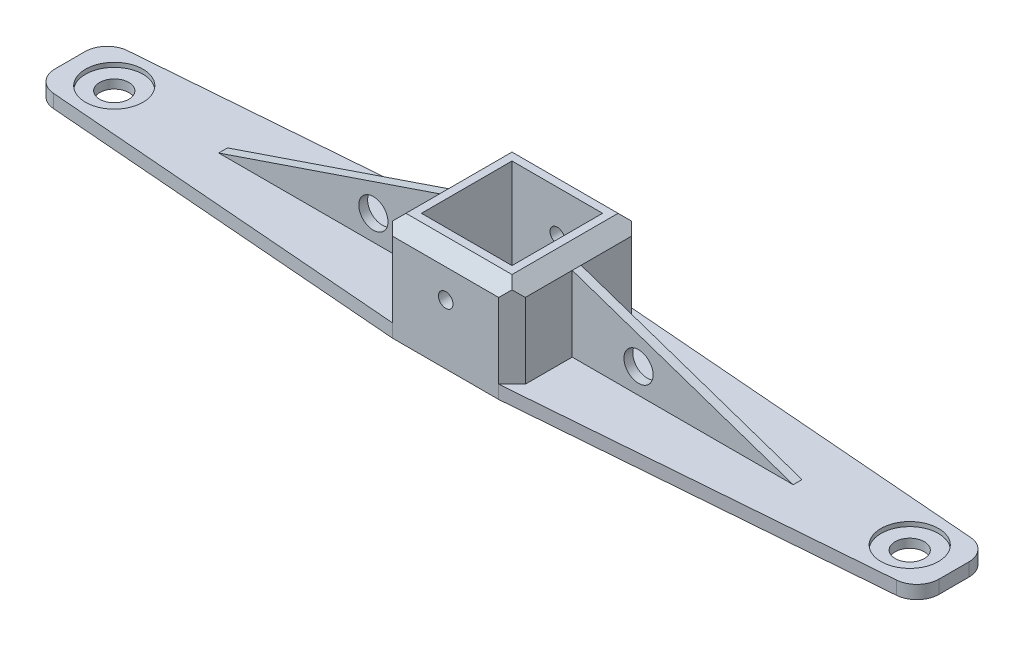
from build123d import *

# Parameters (mm, degrees)
SKETCH1_W           = 200
SKETCH1_H           = 30
BOSS_EXTRUDE1_DEPTH = 3
SKETCH2_W           = 20.5
SKETCH2_H           = 20.5
CUT_EXTRUDE1_DEPTH  = 3
SKETCH3_W           = 30
SKETCH3_H           = 30
SKETCH3_W_2         = 20.5
SKETCH3_H_2         = 20.5
BOSS_EXTRUDE2_DEPTH = 20
CHAMFER1_SIZE       = 3
SKETCH4_R           = 1.65
CUT_EXTRUDE2_DEPTH  = 40
CHAMFER2_SIZE       = 3
CUT_EXTRUDE3_DEPTH  = 40
SKETCH6_W           = 50
SKETCH6_H           = 2
BOSS_EXTRUDE3_DEPTH = 17
CUT_EXTRUDE4_DEPTH  = 17
SKETCH8_R           = 3.302
CUT_EXTRUDE5_DEPTH  = 17
SKETCH9_R           = 3.302
CUT_EXTRUDE6_DEPTH  = 17
SKETCH10_R          = 6.5
CUT_EXTRUDE7_DEPTH  = 1
SKETCH11_R          = 6.5
CUT_EXTRUDE8_DEPTH  = 1
FILLET1_R           = 5


with BuildPart() as part:
    # Sketch1 → Boss-Extrude1 (new body)
    with BuildSketch(Plane(origin=(0, 0, 0), x_dir=(1, 0, 0), z_dir=(0, 1, 0))):
        Rectangle(SKETCH1_W, SKETCH1_H)
    extrude(amount=BOSS_EXTRUDE1_DEPTH)

    # Sketch2 → Cut-Extrude1 (cut)
    with BuildSketch(Plane(origin=(0, 3, 0), x_dir=(1, 0, 0), z_dir=(0, 1, 0))):
        Rectangle(SKETCH2_W, SKETCH2_H)
    extrude(amount=-CUT_EXTRUDE1_DEPTH, mode=Mode.SUBTRACT)

    # Sketch3 → Boss-Extrude2 (add)
    with BuildSketch(Plane(origin=(0, 3, 0), x_dir=(1, 0, 0), z_dir=(0, 1, 0))):
        Rectangle(SKETCH3_W, SKETCH3_H)
        Rectangle(SKETCH3_W_2, SKETCH3_H_2, mode=Mode.SUBTRACT)
    extrude(amount=BOSS_EXTRUDE2_DEPTH)

    # Chamfer1
    chamfer1_edges = [part.edges().sort_by_distance(p)[0] for p in [
        (15, 13, 15),
        (15, 13, -15),
        (-15, 13, -15),
        (-15, 13, 15),
    ]]
    chamfer(chamfer1_edges, length=CHAMFER1_SIZE)

    # Sketch4 → Cut-Extrude2 (cut)
    with BuildSketch(Plane.XY.offset(15)):
        with Locations((0, 13.514664597)):
            Circle(SKETCH4_R)
    extrude(amount=-CUT_EXTRUDE2_DEPTH, mode=Mode.SUBTRACT)

    # Chamfer2
    # the kernel refuses this chamfer: 3 mm, written as the material it takes off along each edge
    with BuildSketch(Plane(origin=(19.715048964, 23, -15), x_dir=(0, -0.9996219169112968, -0.02749587661058619), z_dir=(-1, 0, 0))) as chamfer2_piece_1:
        Polygon((CHAMFER2_SIZE * 0.999621916911, CHAMFER2_SIZE * 0.0274958766106), (-CHAMFER2_SIZE * 0.0274958766106, CHAMFER2_SIZE * 0.999621916911), (0, 0), align=None)
    extrude(amount=39.430097928, mode=Mode.SUBTRACT)
    with BuildSketch(Plane(origin=(15, 23, 19.715048964), x_dir=(-0.9996219169112968, 0.02749587661058678, 0), z_dir=(0, 0, -1)), Plane(origin=(-19.715048964, 23, 15), x_dir=(0, 0.02749587661058678, -0.9996219169112968), z_dir=(1, 0, 0)), Plane(origin=(-15, 23, -19.715048964), x_dir=(0.9996219169112968, 0.02749587661058678, 0), z_dir=(0, 0, 1))) as chamfer2_piece_2:
        Polygon((CHAMFER2_SIZE * 0.999621916911, -CHAMFER2_SIZE * 0.0274958766106), (-CHAMFER2_SIZE * 0.0274958766106, -CHAMFER2_SIZE * 0.999621916911), (0, 0), align=None)
    extrude(amount=39.430097928, mode=Mode.SUBTRACT)

    # Sketch5 → Cut-Extrude3 (cut)
    with BuildSketch(Plane(origin=(0, 3, 0), x_dir=(1, 0, 0), z_dir=(0, 1, 0))):
        Polygon((-12, 15), (-100, 8), (-100, 15), align=None)
        Polygon((-12, -15), (-100, -15), (-100, -8), align=None)
        Polygon((12, 15), (100, 15), (100, 8), align=None)
        Polygon((12, -15), (100, -15), (100, -8), align=None)
    extrude(amount=-CUT_EXTRUDE3_DEPTH, mode=Mode.SUBTRACT)

    # Sketch6 → Boss-Extrude3 (add)
    with BuildSketch(Plane(origin=(0, 3, 0), x_dir=(1, 0, 0), z_dir=(0, 1, 0))):
        with Locations((-40, -0.368394866)):
            Rectangle(SKETCH6_W, SKETCH6_H)
        with Locations((40, -0.368394866)):
            Rectangle(SKETCH6_W, SKETCH6_H)
    extrude(amount=BOSS_EXTRUDE3_DEPTH)

    # Sketch7 → Cut-Extrude4 (cut)
    with BuildSketch(Plane.XY.offset(1.368394866)):
        Polygon((-15, 20), (-65, 3), (-71.38859119, 29.520775186), align=None)
        Polygon((15, 20), (65, 3), (84.413316585, 43.135600108), align=None)
    extrude(amount=-CUT_EXTRUDE4_DEPTH, mode=Mode.SUBTRACT)

    # Sketch8 → Cut-Extrude5 (cut)
    with BuildSketch(Plane.XY.offset(1.368394866)):
        with Locations((-30, 8.659349902)):
            Circle(SKETCH8_R)
        with Locations((30, 8.659349902)):
            Circle(SKETCH8_R)
    extrude(amount=-CUT_EXTRUDE5_DEPTH, mode=Mode.SUBTRACT)

    # Sketch9 → Cut-Extrude6 (cut)
    with BuildSketch(Plane(origin=(0, 3, 0), x_dir=(1, 0, 0), z_dir=(0, 1, 0))):
        with Locations(Location((-90, 0, 0), (0, 0, 270))):
            Circle(SKETCH9_R)
        with Locations(Location((90, 0, 0), (0, 0, 270))):
            Circle(SKETCH9_R)
    extrude(amount=-CUT_EXTRUDE6_DEPTH, mode=Mode.SUBTRACT)

    # Sketch10 → Cut-Extrude7 (cut)
    with BuildSketch(Plane(origin=(0, 3, 0), x_dir=(1, 0, 0), z_dir=(0, 1, 0))):
        with Locations(Location((90, 0, 0), (0, 0, 270))):
            Circle(SKETCH10_R)
    extrude(amount=-CUT_EXTRUDE7_DEPTH, mode=Mode.SUBTRACT)

    # Sketch11 → Cut-Extrude8 (cut)
    with BuildSketch(Plane(origin=(0, 3, 0), x_dir=(1, 0, 0), z_dir=(0, 1, 0))):
        with Locations(Location((-90, 0, 0), (0, 0, 270))):
            Circle(SKETCH11_R)
    extrude(amount=-CUT_EXTRUDE8_DEPTH, mode=Mode.SUBTRACT)

    # Fillet1
    fillet1_edges = [part.edges().sort_by_distance(p)[0] for p in [
        (-100, 1.5, -8),
        (-100, 1.5, 8),
        (100, 1.5, -8),
        (100, 1.5, 8),
    ]]
    fillet(fillet1_edges, radius=FILLET1_R)


solid = part.part
